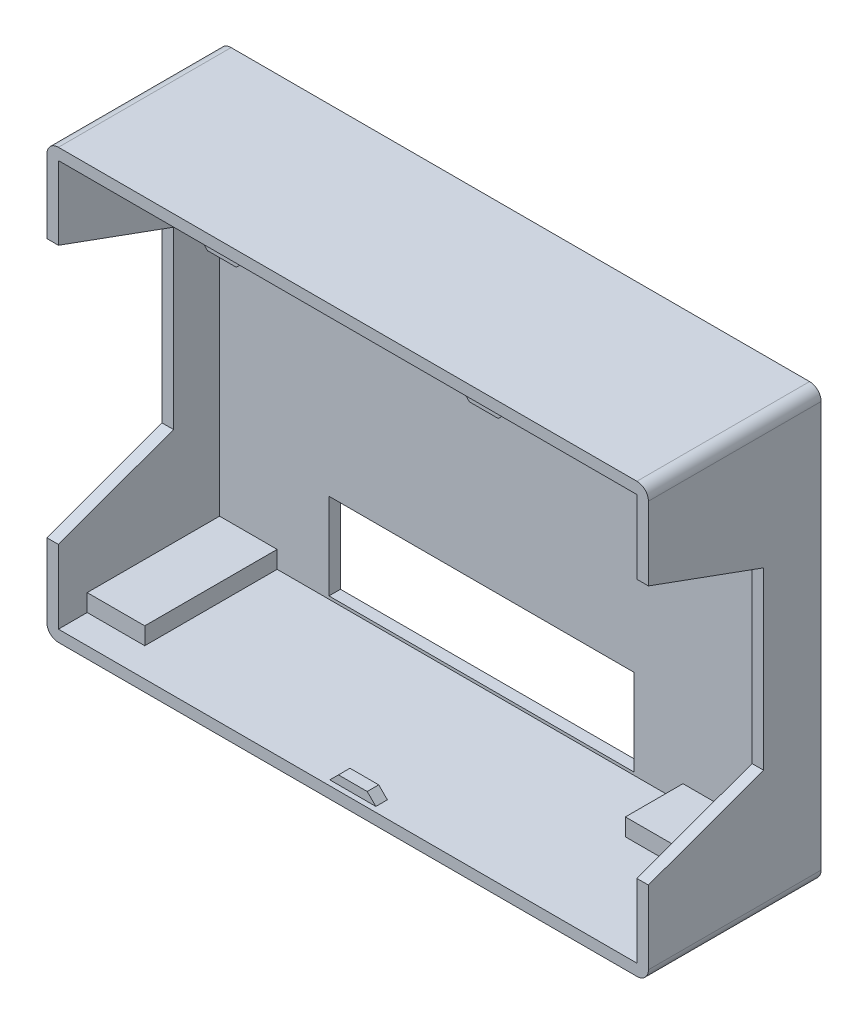
from build123d import *

# Parameters (mm, degrees)
SKETCH1_W                               = 74.5
SKETCH1_H                               = 104.5
SKETCH1_W_2                             = 70.5
SKETCH1_H_2                             = 100.5
BOSS_EXTRUDE1_ABOVE_BOARD_SURFACE_DEPTH = 5
SKETCH2_W                               = 104.5
SKETCH2_H                               = 74.5
BOSS_EXTRUDE2_UNDER_23MM_DEPTH          = 23
SKETCH3_W                               = 104.5
SKETCH3_H                               = 74.5
BOSS_EXTRUDE3_BOTTOM_COVER_2MM_DEPTH    = 2
SKETCH4_W                               = 5
SKETCH4_H                               = 3.5
BOSS_EXTRUDE4_ANCHOR_PINS_DEPTH         = 2
SKETCH5_W                               = 150
SKETCH5_H                               = 45
CUT_EXTRUDE1_CUT_USB_DEPTH              = 20
CUT_EXTRUDE1_CUT_USB_DRAFT              = -20
FILLET1_R                               = 2
CHAMFER2_SIZE                           = 1.5
SKETCH6_W                               = 10
SKETCH6_H                               = 3
BOSS_EXTRUDE1_DEPTH                     = 10
SKETCH7_W                               = 53
SKETCH7_H                               = 15
CUT_EXTRUDE1_DEPTH                      = 10


with BuildPart() as part:
    # Sketch1 → Boss-Extrude1-above-board-surface (new body)
    with BuildSketch(Plane(origin=(0, 0, 0), x_dir=(0, 1, 0), z_dir=(0, 0, 1))):
        Rectangle(SKETCH1_W, SKETCH1_H)
        Rectangle(SKETCH1_W_2, SKETCH1_H_2, mode=Mode.SUBTRACT)
    extrude(amount=BOSS_EXTRUDE1_ABOVE_BOARD_SURFACE_DEPTH)

    # Sketch2 → Boss-Extrude2-under-23mm (add)
    with BuildSketch(Plane(origin=(0, 0, 0), x_dir=(1, 0, 0), z_dir=(0, 0, -1))):
        Rectangle(SKETCH2_W, SKETCH2_H)
        Polygon((-50.25, 32.25), (-40.25, 32.25), (-40.25, 35.25), (50.25, 35.25), (50.25, -35.25), (-40.25, -35.25), (-40.25, -32.25), (-50.25, -32.25), align=None, mode=Mode.SUBTRACT)
    extrude(amount=BOSS_EXTRUDE2_UNDER_23MM_DEPTH)

    # Sketch3 → Boss-Extrude3-bottom-cover-2mm (add)
    with BuildSketch(Plane(origin=(0, 0, -23), x_dir=(1, 0, 0), z_dir=(0, 0, -1))):
        Rectangle(SKETCH3_W, SKETCH3_H)
    extrude(amount=BOSS_EXTRUDE3_BOTTOM_COVER_2MM_DEPTH)

    # Sketch4 → Boss-Extrude4-anchor-pins (add)
    with BuildSketch(Plane.XY.offset(2.1)):
        with Locations((-22.75, 35.5)):
            Rectangle(SKETCH4_W, SKETCH4_H)
        with Locations((22.75, 35.5)):
            Rectangle(SKETCH4_W, SKETCH4_H)
        with Locations((0, -35.5)):
            Rectangle(SKETCH4_W, SKETCH4_H)
    extrude(amount=BOSS_EXTRUDE4_ANCHOR_PINS_DEPTH)


with BuildPart() as cut_extrude1_cut_usb_tool:
    # Sketch5 → Cut-Extrude1-cut-usb (with draft: the straight prism first)
    with BuildSketch(Plane.XY.offset(5)):
        Rectangle(SKETCH5_W, SKETCH5_H)
    extrude(amount=-CUT_EXTRUDE1_CUT_USB_DEPTH)
    # Cut-Extrude1-cut-usb: the draft: its side faces are tilted about the plane it starts from
    cut_extrude1_cut_usb_sides = [cut_extrude1_cut_usb_tool.faces().sort_by_distance(p)[0] for p in [
        (0, -22.5, -5),
        (75, 0, -5),
        (0, 22.5, -5),
        (-75, 0, -5),
    ]]
    draft(cut_extrude1_cut_usb_sides, Plane.XY.offset(5), CUT_EXTRUDE1_CUT_USB_DRAFT)


with BuildPart() as part_1:
    add(part.part)

    # Cut-Extrude1-cut-usb: cut by cut_extrude1_cut_usb_tool
    add(cut_extrude1_cut_usb_tool.part, mode=Mode.SUBTRACT)

    # Fillet1
    fillet1_edges = [part_1.edges().sort_by_distance(p)[0] for p in [
        (52.25, -37.25, -10),
        (-52.25, -37.25, -10),
        (-52.25, 37.25, -10),
        (52.25, 37.25, -10),
    ]]
    fillet(fillet1_edges, radius=FILLET1_R)

    # Chamfer2
    chamfer2_edges = [part_1.edges().sort_by_distance(p)[0] for p in [
        (20.25, 35.25, 3.1),
        (25.25, 35.25, 3.1),
        (-25.25, 35.25, 3.1),
        (-20.25, 35.25, 3.1),
        (2.5, -35.25, 3.1),
        (-2.5, -35.25, 3.1),
    ]]
    chamfer(chamfer2_edges, length=CHAMFER2_SIZE - 0.0001)  # a hair under: the kernel refuses the full size

    # Sketch6 → Boss-Extrude1 (add)
    with BuildSketch(Plane.XY.offset(-13)):
        with Locations((35.25, -33.75)):
            Rectangle(SKETCH6_W, SKETCH6_H)
        with Locations((35.25, 33.75)):
            Rectangle(SKETCH6_W, SKETCH6_H)
    extrude(amount=-BOSS_EXTRUDE1_DEPTH)

    # Sketch7 → Cut-Extrude1 (cut)
    with BuildSketch(Plane.XY.offset(-23)):
        with Locations((-4.75, 27.25)):
            Rectangle(SKETCH7_W, SKETCH7_H)
        with Locations((-4.75, -27.25)):
            Rectangle(SKETCH7_W, SKETCH7_H)
    extrude(amount=-CUT_EXTRUDE1_DEPTH, mode=Mode.SUBTRACT)


solid = part_1.part
